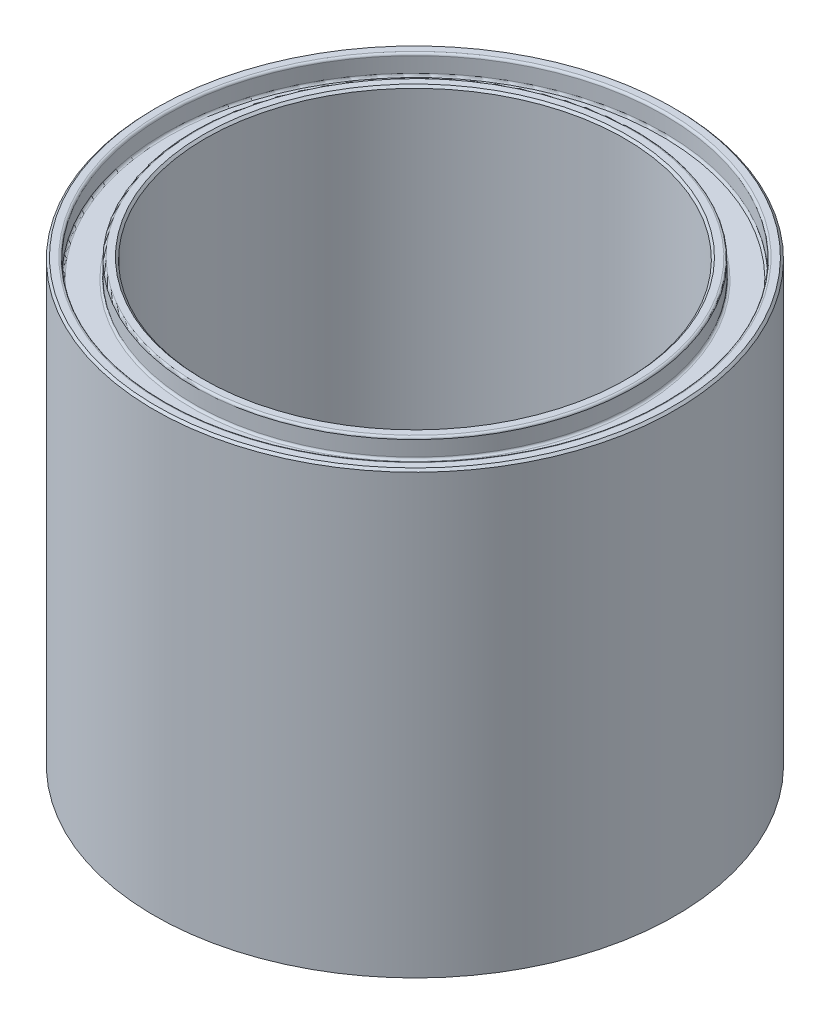
from build123d import *

# Parameters (mm, degrees)
FILLET1_R     = 0.396875
CHAMFER1_SIZE = 0.396875


with BuildPart() as part:
    # Sketch1 → Revolve1 (revolve)
    with BuildSketch(Plane.XY):
        with BuildLine():
            Line((0, 0), (-47.3705, 0))
            Line((-47.3705, 0), (-47.3705, 80))
            Line((-47.3705, 80), (-45.3705, 80))
            Line((-45.3705, 80), (-45.3705, 76.444))
            Line((-45.3705, 76.444), (-40.1, 76.444))
            Line((-40.1, 76.444), (-40.1, 80))
            Line((-40.1, 80), (-38.1, 80))
            Line((-38.1, 80), (-38.1, 15.5))
            ThreePointArc((-38.1, 15.5), (-35.171067812, 8.428932188), (-28.1, 5.5))
            Line((-28.1, 5.5), (0, 5.5))
            Line((0, 5.5), (0, 0))
        make_face()
    revolve(axis=Axis((0, 5.5, 0), (0, -1, 0)))

    # Fillet1
    fillet1_edges = [part.edges().sort_by_distance(p)[0] for p in [
        (40.1, 76.444, 0),
        (45.3705, 80, 0),
        (45.3705, 76.444, 0),
        (40.1, 80, 0),
    ]]
    fillet(fillet1_edges, radius=FILLET1_R)

    # Chamfer1
    chamfer1_edges = [part.edges().sort_by_distance(p)[0] for p in [
        (38.1, 80, 0),
        (47.3705, 80, 0),
    ]]
    chamfer(chamfer1_edges, length=CHAMFER1_SIZE)


solid = part.part
